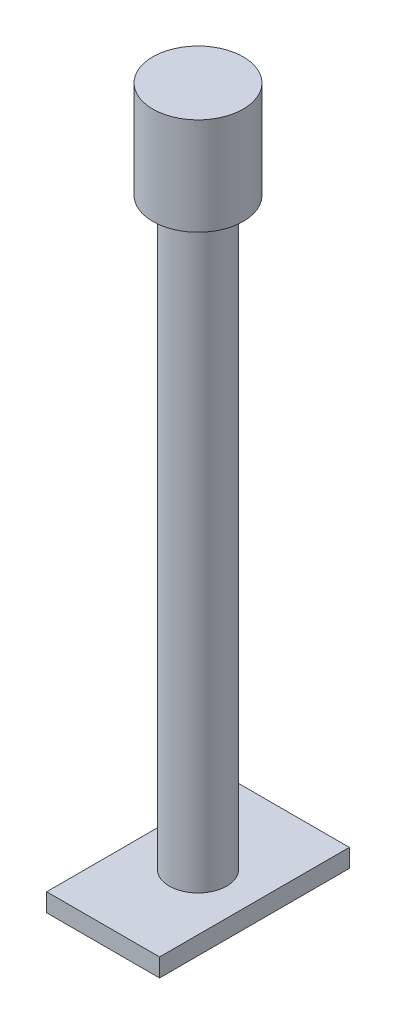
from build123d import *

# Parameters (mm, degrees)
SKETCH1_R           = 7.493
BOSS_EXTRUDE1_DEPTH = 152.4
SKETCH2_W           = 29.464
SKETCH2_H           = 49.53
BOSS_EXTRUDE2_DEPTH = 4.7625
SKETCH3_R           = 11.811
BOSS_EXTRUDE3_DEPTH = 25.4


with BuildPart() as part:
    # Sketch1 → Boss-Extrude1 (new body)
    with BuildSketch(Plane(origin=(0, 0, 0), x_dir=(1, 0, 0), z_dir=(0, 1, 0))):
        Circle(SKETCH1_R)
    extrude(amount=BOSS_EXTRUDE1_DEPTH)

    # Sketch2 → Boss-Extrude2 (add)
    with BuildSketch(Plane.XZ):
        Rectangle(SKETCH2_W, SKETCH2_H)
    extrude(amount=BOSS_EXTRUDE2_DEPTH)

    # Sketch3 → Boss-Extrude3 (add)
    with BuildSketch(Plane(origin=(0, 152.4, 0), x_dir=(1, 0, 0), z_dir=(0, 1, 0))):
        Circle(SKETCH3_R)
    extrude(amount=BOSS_EXTRUDE3_DEPTH)


solid = part.part
